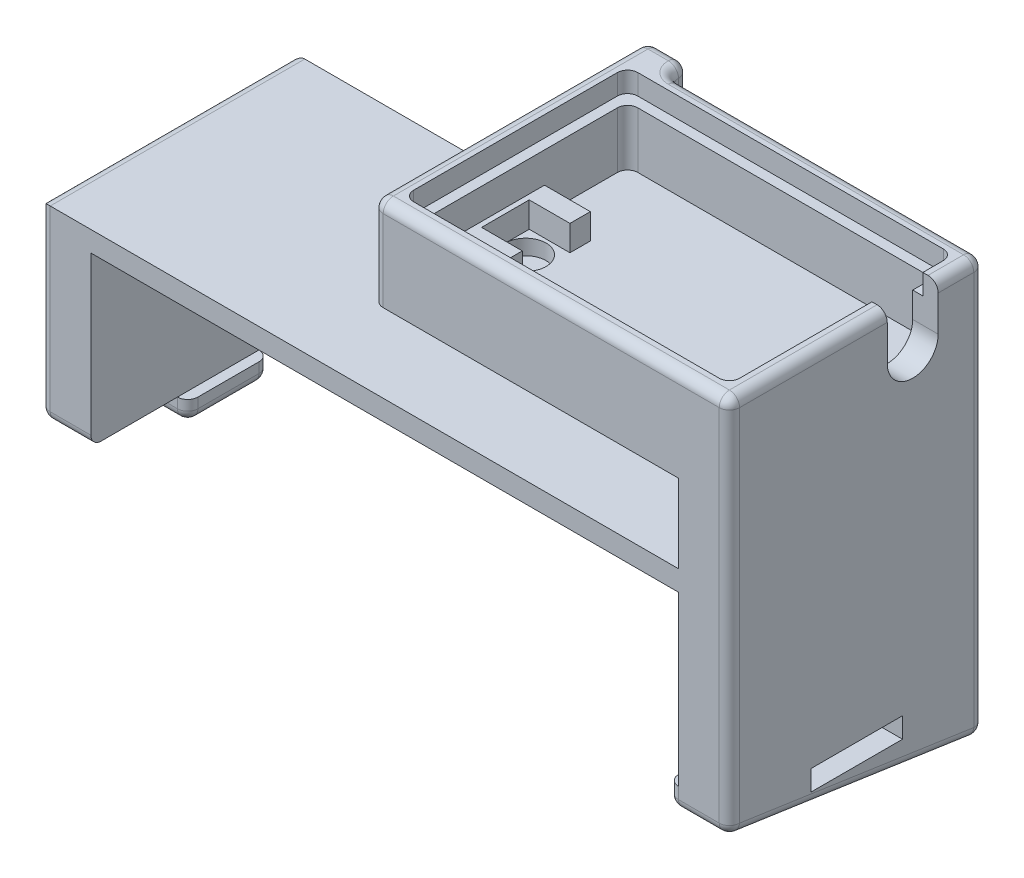
from build123d import *

# Parameters (mm, degrees)
BOSS_EXTRUDE1_DEPTH = 25
SKETCH2_W           = 57.7
SKETCH2_H           = 16.5
CUT_EXTRUDE1_DEPTH  = 51.363081717
SKETCH3_W           = 30
SKETCH3_H           = 20
CUT_EXTRUDE2_DEPTH  = 7.5
CUT_EXTRUDE3_REACH  = 57.579
SKETCH4_R           = 2
SKETCH5_R           = 2
CUT_EXTRUDE4_DEPTH  = 1.5
SKETCH6_W           = 6
SKETCH6_H           = 8
BOSS_EXTRUDE2_DEPTH = 2
BOSS_EXTRUDE4_DEPTH = 6
SKETCH9_W           = 32
SKETCH9_H           = 22
CUT_EXTRUDE5_DEPTH  = 2
FILLET1_R           = 1
SKETCH10_R          = 1
BOSS_EXTRUDE5_DEPTH = 1.5
FILLET3_R           = 1
SKETCH7_W           = 4
SKETCH7_H           = 18.7
BOSS_EXTRUDE6_DEPTH = 2
FILLET4_R           = 1
SKETCH11_W          = 4.5
SKETCH11_H          = 2
BOSS_EXTRUDE7_DEPTH = 2.5
SKETCH12_W          = 0.5
SKETCH12_H          = 4.68
BOSS_EXTRUDE8_DEPTH = 2.5
CUT_EXTRUDE6_REACH  = 80.825


with BuildPart() as part:
    # Sketch1 → Boss-Extrude1 (new body)
    with BuildSketch(Plane.XY):
        Polygon((0, 0), (30, 0), (30, -7.7), (-32.7, -7.7), (-32.7, -26.2), (35, -26.2), (35, 9), (0, 9), align=None)
    extrude(amount=BOSS_EXTRUDE1_DEPTH)

    # Sketch2 → Cut-Extrude1 (cut, through all)
    with BuildSketch(Plane.XY.offset(25)):
        with Locations((1.15, -17.95)):
            Rectangle(SKETCH2_W, SKETCH2_H)
    extrude(amount=-CUT_EXTRUDE1_DEPTH, mode=Mode.SUBTRACT)

    # Sketch3 → Cut-Extrude2 (cut)
    with BuildSketch(Plane(origin=(0, 9, 0), x_dir=(1, 0, 0), z_dir=(0, 1, 0))):
        with Locations((17.5, -12.5)):
            Rectangle(SKETCH3_W, SKETCH3_H)
    extrude(amount=-CUT_EXTRUDE2_DEPTH, mode=Mode.SUBTRACT)

    # Cut-Extrude3: up to this face of the body (flat: up to its plane)
    cut_extrude3_end = Plane(part.part.faces().sort_by_distance((17.5, 1.5, 12.5))[0])
    # Sketch4 → Cut-Extrude3 (cut, up to the picked face)
    with BuildSketch(Plane.XZ.offset(26.2), mode=Mode.PRIVATE) as cut_extrude3_sk1:
        with Locations(Location((30.5, 12.5, 0), (0, 0, 255.522487814))):
            Circle(SKETCH4_R)
    cut_extrude3_tool1 = split(extrude(cut_extrude3_sk1.sketch, amount=-CUT_EXTRUDE3_REACH, mode=Mode.PRIVATE), bisect_by=cut_extrude3_end, keep=Keep.BOTH, mode=Mode.PRIVATE)
    add(cut_extrude3_tool1.solids().sort_by(Axis((30.5, -26.2, 12.5), (0, 1, 0)))[0], mode=Mode.SUBTRACT)

    # Sketch5 → Cut-Extrude4 (cut)
    with BuildSketch(Plane(origin=(0, 1.5, 0), x_dir=(1, 0, 0), z_dir=(0, 1, 0))):
        with Locations(Location((5, -15, 0), (0, 0, 180))):
            Circle(SKETCH5_R)
    extrude(amount=-CUT_EXTRUDE4_DEPTH, mode=Mode.SUBTRACT)

    # Sketch6 → Boss-Extrude2 (add)
    with BuildSketch(Plane.XZ.offset(26.2)):
        with Locations((32, 21)):
            Rectangle(SKETCH6_W, SKETCH6_H)
        with Locations((32, 4)):
            Rectangle(SKETCH6_W, SKETCH6_H)
        with Locations((-29.7, 12.5)):
            Rectangle(SKETCH6_W, SKETCH6_H)
    extrude(amount=BOSS_EXTRUDE2_DEPTH)

    # Sketch8 → Boss-Extrude4 (add)
    with BuildSketch(Plane(origin=(35, 0, 0), x_dir=(0, 0, -1), z_dir=(1, 0, 0))):
        Polygon((-25, -28.2), (0, -31.86), (0, -28.2), align=None)
    extrude(amount=-BOSS_EXTRUDE4_DEPTH)

    # Sketch9 → Cut-Extrude5 (cut)
    with BuildSketch(Plane(origin=(0, 9, 0), x_dir=(1, 0, 0), z_dir=(0, 1, 0))):
        with Locations((17.5, -12.5)):
            Rectangle(SKETCH9_W, SKETCH9_H)
    extrude(amount=-CUT_EXTRUDE5_DEPTH, mode=Mode.SUBTRACT)

    # Fillet1
    fillet1_edges = [part.edges().sort_by_distance(p)[0] for p in [
        (33.5, 8, 1.5),
        (33.5, 8, 23.5),
        (1.5, 8, 23.5),
        (1.5, 8, 1.5),
        (2.5, 4.25, 22.5),
        (2.5, 4.25, 2.5),
        (32.5, 4.25, 2.5),
        (32.5, 4.25, 22.5),
    ]]
    fillet(fillet1_edges, radius=FILLET1_R)

    # Sketch10 → Boss-Extrude5 (add)
    with BuildSketch(Plane(origin=(-27.7, 0, 0), x_dir=(0, 0, -1), z_dir=(1, 0, 0))):
        with Locations(Location((-14, -12.05, 0), (0, 0, 180))):
            Circle(SKETCH10_R)
        with Locations(Location((-11, -12.05, 0), (0, 0, 180))):
            Circle(SKETCH10_R)
    extrude(amount=BOSS_EXTRUDE5_DEPTH)

    # Fillet3
    fillet3_edges = [part.edges().sort_by_distance(p)[0] for p in [
        (-26.2, -12.05, 13),
        (-26.2, -12.05, 10),
    ]]
    fillet(fillet3_edges, radius=FILLET3_R)

    # Sketch7 → Boss-Extrude6 (add)
    with BuildSketch(Plane.XY):
        with Locations((2, -0.35)):
            Rectangle(SKETCH7_W, SKETCH7_H)
    extrude(amount=-BOSS_EXTRUDE6_DEPTH)

    # Fillet4
    fillet4_edges = [part.edges().sort_by_distance(p)[0] for p in [
        (4, -8.7, 0),
        (4, 4.5, 0),
    ]]
    fillet(fillet4_edges, radius=FILLET4_R)
    fillet4_2_edges = [part.edges().sort_by_distance(p)[0] for p in [
        (-29.7, -28.2, 16.5),
        (-26.7, -28.2, 12.5),
        (-29.7, -28.2, 8.5),
        (-32.7, -28.2, 12.5),
        (32, -31.86, 0),
        (32, -28.2, 25),
        (29, -30.03, 12.5),
        (35, -30.03, 12.5),
        (-30.2, -26.2, 0),
        (-30.2, -26.2, 25),
        (29, -29.03, 0),
        (29, -27.2, 25),
        (-26.7, -27.2, 8.5),
        (-26.7, -27.2, 16.5),
        (-32.7, -27.2, 8.5),
        (-32.7, -27.2, 16.5),
        (-32.7, -26.2, 4.25),
        (-32.7, -26.2, 20.75),
        (-32.7, -16.95, 0),
        (-32.7, -16.95, 25),
        (-32.7, -7.7, 12.5),
        (4, -0.35, -2),
        (2, -9.7, -2),
        (20, 9, 0),
        (2, 9, -2),
        (0, -0.35, -2),
        (0, 9, 11.5),
        (0, 4.5, 25),
        (17.5, 9, 25),
        (35, 9, 12.5),
        (35, -9.6, 25),
        (35, -11.43, 0),
        (4.292893219, 9, -0.292893219),
    ]]
    fillet(fillet4_2_edges, radius=FILLET4_R - 0.0001)  # a hair under: the kernel refuses the full size

    # Sketch11 → Boss-Extrude7 (add)
    with BuildSketch(Plane(origin=(0, 1.5, 0), x_dir=(1, 0, 0), z_dir=(0, 1, 0))):
        with Locations((4.75, -18.34)):
            Rectangle(SKETCH11_W, SKETCH11_H)
        with Locations((4.75, -11.66)):
            Rectangle(SKETCH11_W, SKETCH11_H)
    extrude(amount=BOSS_EXTRUDE7_DEPTH)

    # Sketch12 → Boss-Extrude8 (add)
    with BuildSketch(Plane(origin=(0, 1.5, 0), x_dir=(1, 0, 0), z_dir=(0, 1, 0))):
        with Locations((2.75, -15)):
            Rectangle(SKETCH12_W, SKETCH12_H)
    extrude(amount=BOSS_EXTRUDE8_DEPTH)

    # Cut-Extrude6: up to this face of the body (flat: up to its plane)
    cut_extrude6_end = Plane(part.part.faces().sort_by_distance((32.5, 4.25, 12.5))[0])
    # Sketch13 → Cut-Extrude6 (cut, up to the picked face)
    with BuildSketch(Plane(origin=(35, 0, 0), x_dir=(0, 0, -1), z_dir=(1, 0, 0)), mode=Mode.PRIVATE) as cut_extrude6_sk1:
        with BuildLine():
            Line((-9.5, 9), (-9.5, 4.5))
            ThreePointArc((-9.5, 4.5), (-7, 2), (-4.5, 4.5))
            Line((-4.5, 4.5), (-4.5, 9))
            Line((-4.5, 9), (-9.5, 9))
        make_face()
    cut_extrude6_tool1 = split(extrude(cut_extrude6_sk1.sketch, amount=-CUT_EXTRUDE6_REACH, mode=Mode.PRIVATE), bisect_by=cut_extrude6_end, keep=Keep.BOTH, mode=Mode.PRIVATE)
    add(cut_extrude6_tool1.solids().sort_by(Axis((35, 5.744167, 7), (-1, 0, 0)))[0], mode=Mode.SUBTRACT)


solid = part.part
